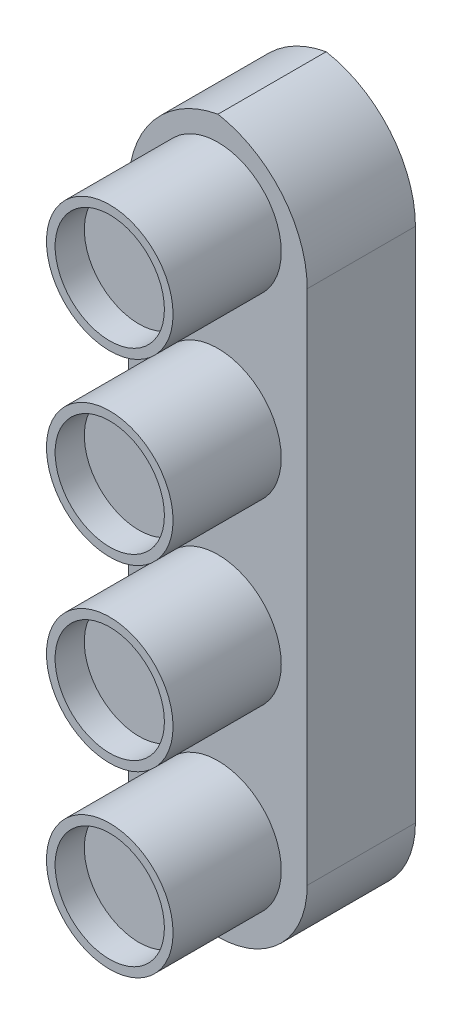
from build123d import *

# Parameters (mm, degrees)
SKETCH1_W                       = 16.5
SKETCH1_H                       = 66
BOSS_EXTRUDE1_DEPTH             = 20
SKETCH2_W                       = 16.5
SKETCH2_H                       = 33
SKETCH2_R                       = 5.85
SKETCH2_R_2                     = 5.05
CUT_EXTRUDE1_DEPTH              = 10
FILLET1_R                       = 10
FILLET2_R                       = 8.25
SKIZZE1_R                       = 5.1
AUFSATZ_LINEAR_AUSTRAGEN1_DEPTH = 7.3
SCHNITT_LINEAR_AUSTRAGEN1_DEPTH = 9


# Some blends are built 0.0001 mm under size
with BuildPart() as part:
    # Sketch1 → Boss-Extrude1 (new body)
    with BuildSketch(Plane.XY):
        with Locations((-120.834022786, 132)):
            Rectangle(SKETCH1_W, SKETCH1_H)
    extrude(amount=BOSS_EXTRUDE1_DEPTH)

    # Sketch2 → Cut-Extrude1 (cut)
    # profile 1 of 6: a face of its own
    with BuildSketch(Plane.XY.offset(20)):
        with Locations((-120.834022786, 115.5)):
            Rectangle(SKETCH2_W, SKETCH2_H)
        with Locations((-120.834022786, 107.25)):
            Circle(SKETCH2_R, mode=Mode.SUBTRACT)
        with Locations((-120.834022786, 123.75)):
            Circle(SKETCH2_R, mode=Mode.SUBTRACT)
    # profile 2 of 6: a face of its own
    with BuildSketch(Plane.XY.offset(20)):
        with Locations((-120.834022786, 148.5)):
            Rectangle(SKETCH2_W, SKETCH2_H)
        with Locations((-120.834022786, 140.25)):
            Circle(SKETCH2_R, mode=Mode.SUBTRACT)
        with Locations((-120.834022786, 156.75)):
            Circle(SKETCH2_R, mode=Mode.SUBTRACT)
    # profile 3 of 6: a face of its own
    with BuildSketch(Plane.XY.offset(20)):
        with Locations((-120.834022786, 140.25)):
            Circle(SKETCH2_R_2)
    # profile 4 of 6: a face of its own
    with BuildSketch(Plane.XY.offset(20)):
        with Locations((-120.834022786, 123.75)):
            Circle(SKETCH2_R_2)
    # profile 5 of 6: a face of its own
    with BuildSketch(Plane.XY.offset(20)):
        with Locations((-120.834022786, 107.25)):
            Circle(SKETCH2_R_2)
    # profile 6 of 6: a face of its own
    with BuildSketch(Plane.XY.offset(20)):
        with Locations((-120.834022786, 156.75)):
            Circle(SKETCH2_R_2)
    extrude(amount=-CUT_EXTRUDE1_DEPTH, mode=Mode.SUBTRACT)

    # Fillet1
    # the kernel refuses this fillet: 10 mm, written as the material it takes off along each edge
    with BuildSketch(Plane(origin=(-129.084022786, 165, -25), x_dir=(1, 0, 0), z_dir=(0, 0, 1))) as fillet1_piece_1:
        with BuildLine():
            CenterArc((FILLET1_R, -FILLET1_R), FILLET1_R, 90, 90)
            Line((0, -FILLET1_R), (0, 0))
            Line((0, 0), (FILLET1_R, 0))
        make_face()
    extrude(amount=60, mode=Mode.SUBTRACT)
    with BuildSketch(Plane(origin=(-112.584022786, 165, -25), x_dir=(-1, 0, 0), z_dir=(0, 0, 1))) as fillet1_piece_2:
        with BuildLine():
            CenterArc((FILLET1_R, FILLET1_R), FILLET1_R, 180, 90)
            Line((0, FILLET1_R), (0, 0))
            Line((0, 0), (FILLET1_R, 0))
        make_face()
    extrude(amount=60, mode=Mode.SUBTRACT)

    # Fillet2
    fillet2_edges = [part.edges().sort_by_distance(p)[0] for p in [
        (-129.084022786, 99, 5),
        (-112.584022786, 99, 5),
    ]]
    fillet(fillet2_edges, radius=FILLET2_R - 0.0001)  # a hair under: the kernel refuses the full size

    # Skizze1 → Aufsatz-Linear austragen1 (add)
    with BuildSketch(Plane.XY.offset(10)):
        with Locations((-120.834022786, 156.75)):
            Circle(SKIZZE1_R)
        with Locations((-120.834022786, 140.25)):
            Circle(SKIZZE1_R)
        with Locations((-120.834022786, 123.75)):
            Circle(SKIZZE1_R)
        with Locations((-120.834022786, 107.25)):
            Circle(SKIZZE1_R)
    extrude(amount=AUFSATZ_LINEAR_AUSTRAGEN1_DEPTH)

    # Skizze2 → Schnitt-Linear austragen1 (cut)
    with BuildSketch(Plane(origin=(0, 0, 0), x_dir=(-1, 0, 0), z_dir=(0, 0, -1))):
        with BuildLine():
            Line((127.084022786, 107.25), (127.084022786, 155))
            ThreePointArc((127.084022786, 155), (125.329020784, 160), (120.834022786, 162.806247498))
            ThreePointArc((120.834022786, 162.806247498), (116.339024787, 160), (114.584022786, 155))
            Line((114.584022786, 155), (114.584022786, 107.25))
            ThreePointArc((114.584022786, 107.25), (116.414605403, 102.830582618), (120.834022786, 101))
            ThreePointArc((120.834022786, 101), (125.253440168, 102.830582618), (127.084022786, 107.25))
        make_face()
    extrude(amount=-SCHNITT_LINEAR_AUSTRAGEN1_DEPTH, mode=Mode.SUBTRACT)


solid = part.part
